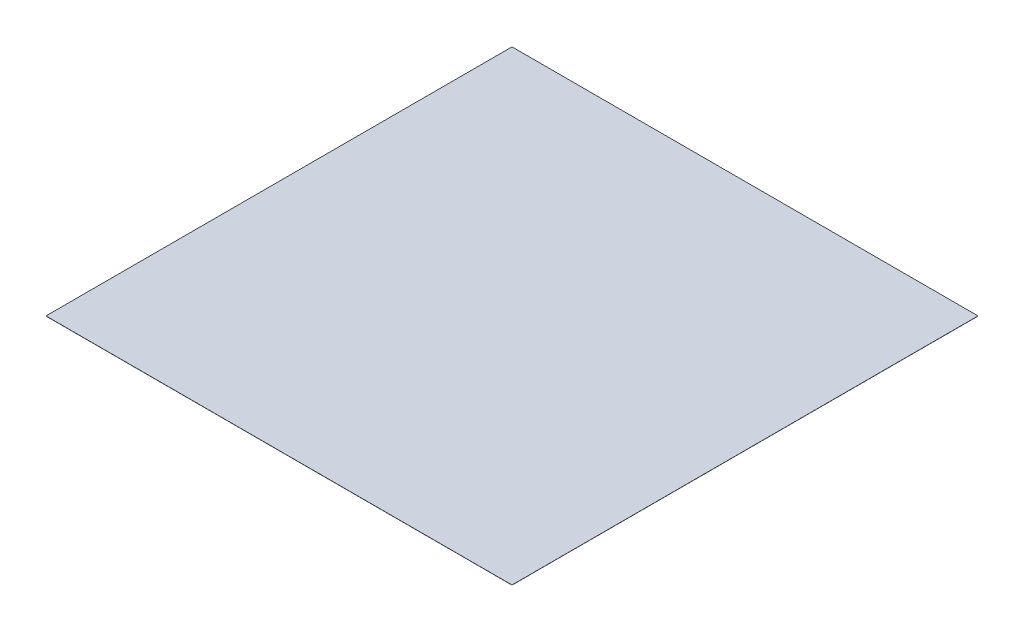
from build123d import *

# Parameters (mm, degrees)
SKETCH1_W           = 7620
SKETCH1_H           = 7620
BOSS_EXTRUDE1_DEPTH = 2.54


with BuildPart() as part:
    # Sketch1 → Boss-Extrude1 (new body)
    with BuildSketch(Plane(origin=(0, 0, 0), x_dir=(1, 0, 0), z_dir=(0, 1, 0))):
        Rectangle(SKETCH1_W, SKETCH1_H)
    extrude(amount=BOSS_EXTRUDE1_DEPTH)


solid = part.part
